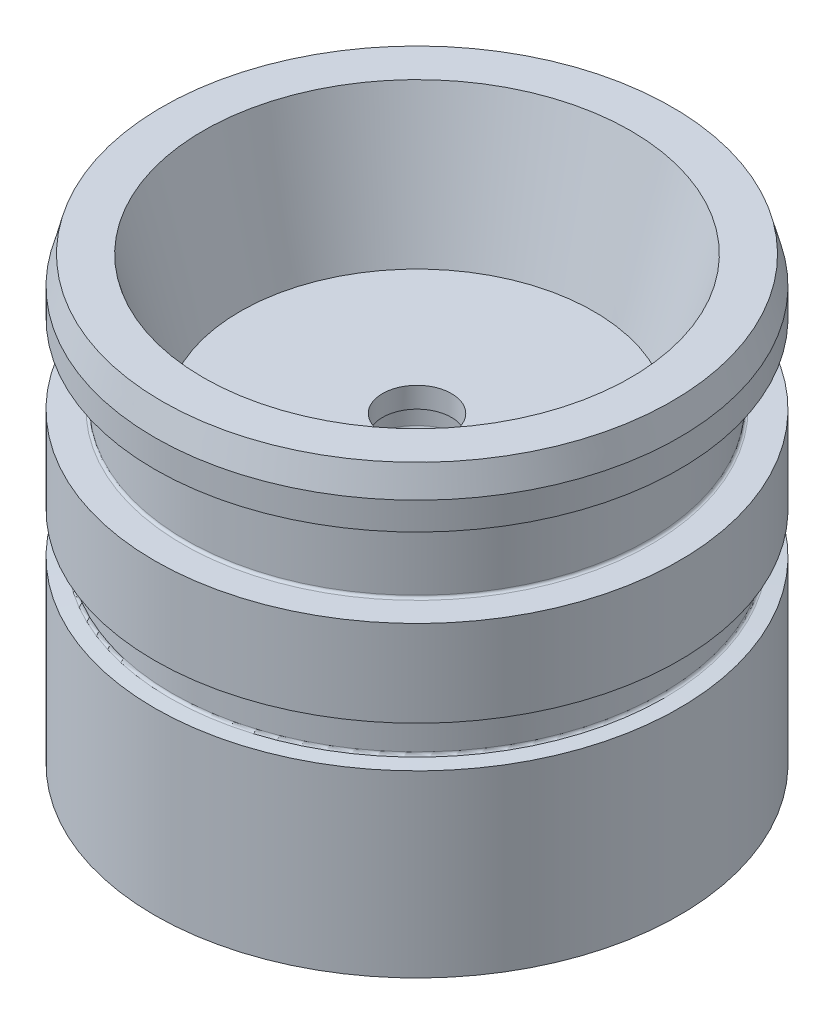
from build123d import *

# Parameters (mm, degrees)
SKETCH1_R                       = 24.1554
BODY_DEPTH                      = 25.4
SKETCH2_R                       = 15.875
LIGHTENING_HOLE_DEPTH           = 12.7
INSTALL_CHAMFER_SIZE            = 2.54
INSTALL_CHAMFER_SIZE2           = 0.680590949
PROP_CHAMFER_SIZE               = 3.81
PROP_CHAMFER_SIZE_2             = 14.219113577
BOTTOM_REDUCE_START             = -12.7
SKETCH6_R                       = 24.1554
BOTTOM_REDUCE_DEPTH             = 12.7
F_1_4_0_25_DIAMETER_HOLE3_D     = 6.35
F_1_4_0_25_DIAMETER_HOLE3_DEPTH = 12.7
F_1_4_0_25_DIAMETER_HOLE3_TIP   = 1.907732465
CIRPATTERN5_COUNT               = 8
SKETCH145_R                     = 24.1554
BOSS_EXTRUDE2_DEPTH             = 2.54
SKETCH143_R                     = 22.1361
CUT_EXTRUDE4_DEPTH              = 7.62


# Read off the part's stored shape, not the designer's step: Groove for AS 568-010, O-Ring2
with BuildPart() as part:
    # Sketch1 → body (new, symmetric)
    with BuildSketch(Plane(origin=(0, 0, 0), x_dir=(1, 0, 0), z_dir=(0, 1, 0))):
        with Locations(Location((0, 0, 0), (0, 0, 270))):
            Circle(SKETCH1_R)
    extrude(amount=BODY_DEPTH, both=True)

    # Sketch2 → lightening hole (cut)
    with BuildSketch(Plane(origin=(0, 25.4, 0), x_dir=(1, 0, 0), z_dir=(0, 1, 0))):
        with Locations(Location((0, 0, 0), (0, 0, 270))):
            Circle(SKETCH2_R)
    lightening_hole = extrude(amount=-LIGHTENING_HOLE_DEPTH, mode=Mode.SUBTRACT)

    # main-o-ring → o-ring-main (with backup rings) (revolve, cut)
    with BuildSketch(Plane.XY, mode=Mode.PRIVATE) as o_ring_main_with_backup_rings_sk:
        with BuildLine():
            Line((-24.1554, 20.32), (-24.1554, 13.0302))
            Line((-24.1554, 13.0302), (-21.550812385, 13.0302))
            ThreePointArc((-21.550812385, 13.0302), (-21.380956579, 13.100556579), (-21.3106, 13.270412385))
            Line((-21.3106, 13.270412385), (-21.3106, 20.079787615))
            ThreePointArc((-21.3106, 20.079787615), (-21.380956579, 20.249643421), (-21.550812385, 20.32))
            Line((-21.550812385, 20.32), (-24.1554, 20.32))
        make_face()
    o_ring_main_with_backup_rings = revolve(o_ring_main_with_backup_rings_sk.sketch.rotate(Axis((0, 0, 0), (0, 1, 0)), 270), axis=Axis((0, 0, 0), (0, 1, 0)), mode=Mode.SUBTRACT)

    # install-chamfer
    install_chamfer_edges = [part.edges().sort_by_distance(p)[0] for p in [
        (0, 25.4, -24.1554),
    ]]
    install_chamfer_side = [part.faces().sort_by_distance(p)[0] for p in [
        (0, 22.86, -24.1554),
    ]]
    chamfer(install_chamfer_edges, length=INSTALL_CHAMFER_SIZE, length2=INSTALL_CHAMFER_SIZE2, reference=install_chamfer_side[0])

    # prop-chamfer
    # the kernel refuses this chamfer: 14.219113577, 3.81 mm, written as the material it takes off along each edge
    with BuildSketch(Plane(origin=(0, 25.4, 0), x_dir=(0, 0, 1), z_dir=(-1, 0, 0))) as prop_chamfer_piece_1_section:
        Polygon((15.875 + PROP_CHAMFER_SIZE, 0), (15.875, -PROP_CHAMFER_SIZE_2), (15.875, 0), align=None)
    prop_chamfer_piece_1 = revolve(axis=Axis((0, 25.4, 0), (0, 1, 0)), mode=Mode.PRIVATE)
    prop_chamfer_piece_1 = split(prop_chamfer_piece_1, bisect_by=Plane(origin=(0, 12.7, -17.911519762), z_dir=(0, 1, 0)), keep=Keep.TOP, mode=Mode.PRIVATE)
    add(prop_chamfer_piece_1, mode=Mode.SUBTRACT)

    # Top-Bottom Symmetry: lightening hole, o-ring-main (with backup rings) across plane
    add(lightening_hole.mirror(Plane.ZX), mode=Mode.SUBTRACT)
    add(o_ring_main_with_backup_rings.mirror(Plane.ZX), mode=Mode.SUBTRACT)

    # Sketch6 → bottom-reduce (cut)
    with BuildSketch(Plane.XZ.offset(25.4).offset(BOTTOM_REDUCE_START)):
        with Locations(Location((0, 0, 0), (0, 0, 270))):
            Circle(SKETCH6_R)
    extrude(amount=BOTTOM_REDUCE_DEPTH, mode=Mode.SUBTRACT)

    # 1/4 (0.25) Diameter Hole3
    with Locations(Plane(origin=(0, 12.7, 0), x_dir=(1, 0, 0), z_dir=(0, 1, 0))):
        with Locations((0, 0)):
            Hole(F_1_4_0_25_DIAMETER_HOLE3_D / 2, depth=F_1_4_0_25_DIAMETER_HOLE3_DEPTH)
            with Locations((0, 0, -(F_1_4_0_25_DIAMETER_HOLE3_DEPTH + F_1_4_0_25_DIAMETER_HOLE3_TIP / 2))):  # 118° drill point
                Cone(0, F_1_4_0_25_DIAMETER_HOLE3_D / 2, F_1_4_0_25_DIAMETER_HOLE3_TIP, mode=Mode.SUBTRACT)

    # Groove for AS 568-010, O-Ring2 outline → Groove for AS 568-010, O-Ring2 (revolve, cut)
    with BuildSketch(Plane.XY):
        with BuildLine():
            Line((4.213137559, 10.7061), (3.175, 10.796925268))
            Line((3.175, 10.796925268), (3.175, 8.253074732))
            Line((3.175, 8.253074732), (4.213137559, 8.3439))
            ThreePointArc((4.213137559, 8.3439), (4.378268444, 8.425333541), (4.445, 8.596933453))
            Line((4.445, 8.596933453), (4.445, 10.453066547))
            ThreePointArc((4.445, 10.453066547), (4.378268444, 10.624666459), (4.213137559, 10.7061))
        make_face()
        with BuildLine():
            Line((4.213137559, 3.7211), (3.175, 3.811925268))
            Line((3.175, 3.811925268), (3.175, 1.268074732))
            Line((3.175, 1.268074732), (4.213137559, 1.3589))
            ThreePointArc((4.213137559, 1.3589), (4.378268444, 1.440333541), (4.445, 1.611933453))
            Line((4.445, 1.611933453), (4.445, 3.468066547))
            ThreePointArc((4.445, 3.468066547), (4.378268444, 3.639666459), (4.213137559, 3.7211))
        make_face()
    revolve(axis=Axis((0, 0, 0), (0, 1, 0)), mode=Mode.SUBTRACT)

    # Sketch112 → Groove for AS 568-132, O-Ring1 (revolve, cut)
    with BuildSketch(Plane(origin=(0, 25.4, 0), x_dir=(0, 0, -1), z_dir=(-1, 0, 0))):
        with BuildLine():
            Line((22.774362441, 24.003), (24.6888, 24.170491583))
            Line((24.6888, 24.170491583), (24.6888, 20.279508417))
            Line((24.6888, 20.279508417), (22.774362441, 20.447))
            ThreePointArc((22.774362441, 20.447), (22.609231556, 20.528433541), (22.5425, 20.700033453))
            Line((22.5425, 20.700033453), (22.5425, 23.749966547))
            ThreePointArc((22.5425, 23.749966547), (22.609231556, 23.921566459), (22.774362441, 24.003))
        make_face()
    revolve(axis=Axis((0, -24.6, 0), (0, 1, 0)), mode=Mode.SUBTRACT)

    # CirPattern5: part ×8 about axis
    cirpattern5_axis = Axis((0, 0, 0), (0, 1, 0))


with BuildPart() as part_1:
    add(part.part)
    for i in range(1, CIRPATTERN5_COUNT):
        add(part.part.rotate(cirpattern5_axis, i * 360 / CIRPATTERN5_COUNT))

    # Sketch145 → Boss-Extrude2 (add)
    with BuildSketch(Plane.XZ.offset(12.7)):
        with Locations(Location((0, 0, 0), (0, 0, 270))):
            Circle(SKETCH145_R)
    extrude(amount=BOSS_EXTRUDE2_DEPTH)

    # Sketch143 → Cut-Extrude4 (cut)
    with BuildSketch(Plane.XZ.offset(15.24)):
        with Locations(Location((0, 0, 0), (0, 0, 270))):
            Circle(SKETCH143_R)
    extrude(amount=-CUT_EXTRUDE4_DEPTH, mode=Mode.SUBTRACT)

    # Sketch144 → Cut-Revolve6 (revolve, cut)
    with BuildSketch(Plane.XY, mode=Mode.PRIVATE) as cut_revolve6_sk:
        Polygon((0, 1.323564938), (-22.1361, -7.62), (0, -7.62), align=None)
    revolve(cut_revolve6_sk.sketch.rotate(Axis((0, 0, 0), (0, -1, 0)), 90), axis=Axis((0, 0, 0), (0, -1, 0)), mode=Mode.SUBTRACT)


solid = part_1.part
